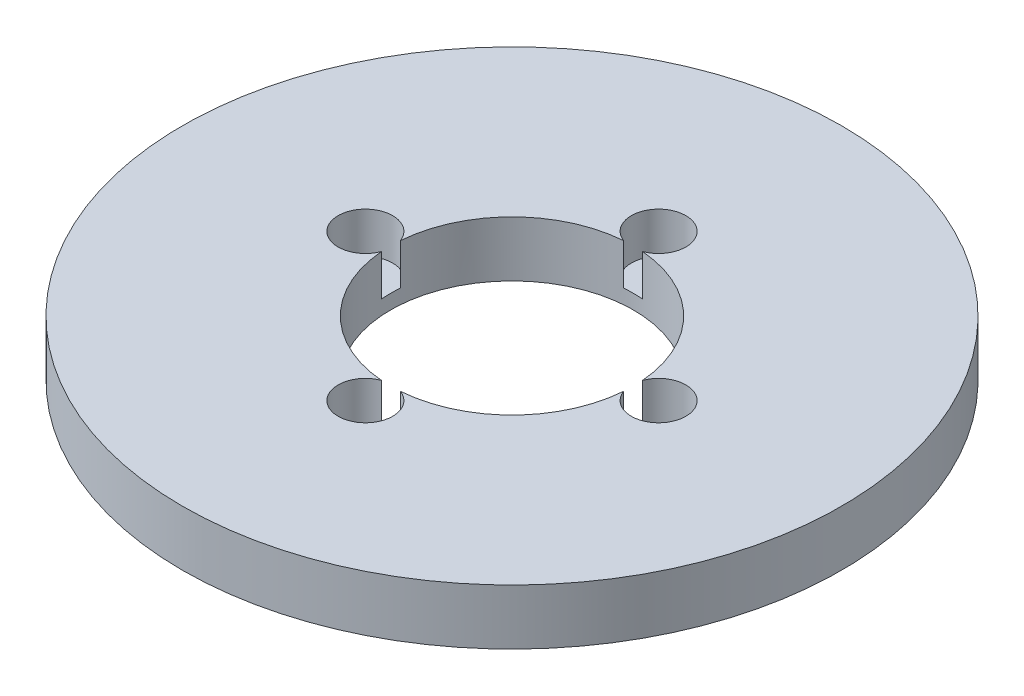
from build123d import *

# Parameters (mm, degrees)
SKETCH1_R           = 95
BOSS_EXTRUDE1_DEPTH = 16
SKETCH2_R           = 35
CUT_EXTRUDE1_DEPTH  = 136.299667405
SKETCH3_R           = 7.850935583
CUT_EXTRUDE2_DEPTH  = 11.845913684
CIRPATTERN1_COUNT   = 4


with BuildPart() as part:
    # Sketch1 → Boss-Extrude1 (new body)
    with BuildSketch(Plane(origin=(0, 0, 0), x_dir=(1, 0, 0), z_dir=(0, 1, 0))):
        Circle(SKETCH1_R)
    extrude(amount=BOSS_EXTRUDE1_DEPTH)

    # Sketch2 → Cut-Extrude1 (cut, through all)
    with BuildSketch(Plane(origin=(0, 0, 0), x_dir=(1, 0, 0), z_dir=(0, 1, 0))):
        Circle(SKETCH2_R)
    extrude(amount=CUT_EXTRUDE1_DEPTH, mode=Mode.SUBTRACT)

    # Sketch3 → Cut-Extrude2 (cut)
    with BuildSketch(Plane(origin=(0, 16, 0), x_dir=(1, 0, 0), z_dir=(0, 1, 0))):
        with Locations((-42.259705449, 0)):
            Circle(SKETCH3_R)
    cut_extrude2 = extrude(amount=-CUT_EXTRUDE2_DEPTH, mode=Mode.SUBTRACT)

    # CirPattern1: Cut-Extrude2 ×4 about axis
    cirpattern1_axis = Axis((0, 0, 0), (0, 1, 0))
    for i in range(1, CIRPATTERN1_COUNT):
        add(cut_extrude2.rotate(cirpattern1_axis, i * 360 / CIRPATTERN1_COUNT), mode=Mode.SUBTRACT)


solid = part.part
